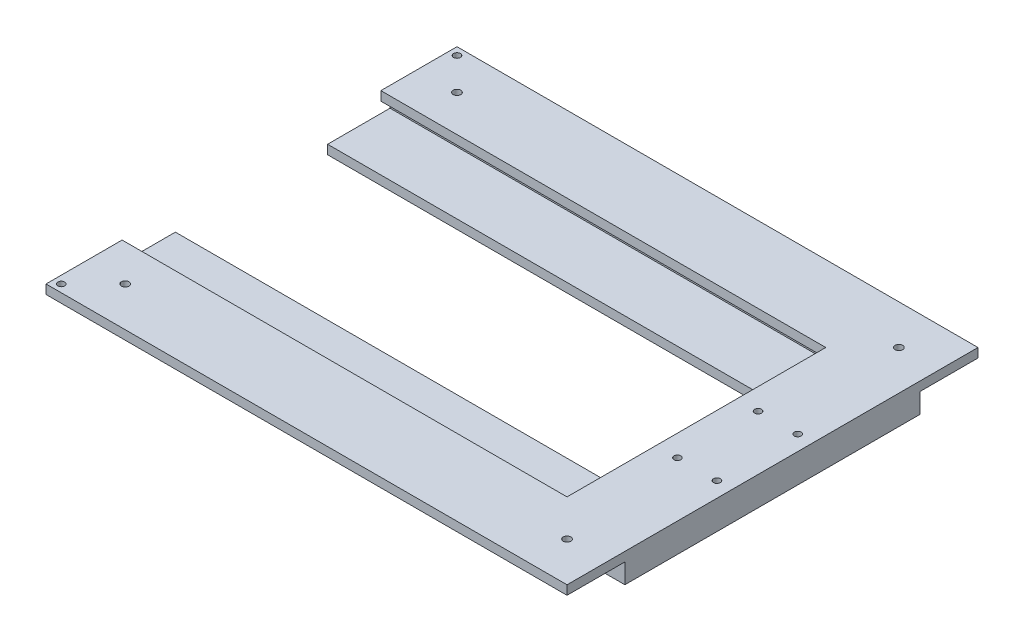
from build123d import *

# Parameters (mm, degrees)
EXTRUDE_2_DEPTH             = 6
EXTRUDE_3_DEPTH             = 7
SKETCH_4_R                  = 2.5
CUT_EXTRUDE_1_DEPTH         = 455.596156824
PATTERN_LINEAR_2_COUNT      = 2
PATTERN_LINEAR_2_PITCH      = 290.3
PATTERN_LINEAR_2_COUNT_DIR2 = 2
PATTERN_LINEAR_2_PITCH_DIR2 = 218
EXTRUDE_4_DEPTH             = 6
SKETCH_6_R                  = 2.25
CUT_EXTRUDE_2_DEPTH         = 455.807284242
SKETCH_7_R                  = 2.25
CUT_EXTRUDE_3_DEPTH         = 455.596156824


with BuildPart() as part:
    # Эскиз1 → Бобышка-Вытянуть2 (new body)
    with BuildSketch(Plane(origin=(0, 0, 0), x_dir=(1, 0, 0), z_dir=(0, 1, 0))):
        Polygon((50, -77.921508101), (50, -347.921508101), (-292.3, -347.921508101), (-292.3, -297.921508101), (0, -297.921508101), (0, -127.921508101), (-292.3, -127.921508101), (-292.3, -77.921508101), align=None)
    extrude(amount=EXTRUDE_2_DEPTH)

    # Эскиз2 → Бобышка-Вытянуть3 (add)
    with BuildSketch(Plane.XZ):
        Polygon((50, 309.921508101), (50, 115.921508101), (-292.3, 115.921508101), (-292.3, 121.921508101), (6, 121.921508101), (6, 303.921508101), (-292.3, 303.921508101), (-292.3, 309.921508101), align=None)
    extrude(amount=EXTRUDE_3_DEPTH)

    # Эскиз4 → Вырез-Вытянуть1 (cut, through all)
    with BuildSketch(Plane(origin=(0, 6, 0), x_dir=(1, 0, 0), z_dir=(0, 1, 0))):
        with Locations((-266.3, -103.921508101)):
            Circle(SKETCH_4_R)
    cut_extrude_1 = extrude(amount=-CUT_EXTRUDE_1_DEPTH, mode=Mode.SUBTRACT)

    # Линейный массив2: Cut-Extrude 1 2 × 2
    with Locations(*[(i * PATTERN_LINEAR_2_PITCH, 0, j * PATTERN_LINEAR_2_PITCH_DIR2) for i in range(PATTERN_LINEAR_2_COUNT) for j in range(PATTERN_LINEAR_2_COUNT_DIR2) if (i, j) != (0, 0)]):
        add(cut_extrude_1, mode=Mode.SUBTRACT)

    # Эскиз5 → Бобышка-Вытянуть4 (add)
    with BuildSketch(Plane.XZ.offset(7)):
        Polygon((50, 309.921508101), (-292.3, 309.921508101), (-292.3, 262.921508101), (0, 262.921508101), (0, 162.921508101), (-292.3, 162.921508101), (-292.3, 115.921508101), (50, 115.921508101), align=None)
    extrude(amount=EXTRUDE_4_DEPTH)

    # Эскиз6 → Вырез-Вытянуть2 (cut, through all)
    with BuildSketch(Plane.XZ.offset(13)):
        with Locations((14, 239.421508101)):
            Circle(SKETCH_6_R)
        with Locations((40, 239.421508101)):
            Circle(SKETCH_6_R)
        with Locations((40, 186.421508101)):
            Circle(SKETCH_6_R)
        with Locations((14, 186.421508101)):
            Circle(SKETCH_6_R)
    extrude(amount=-CUT_EXTRUDE_2_DEPTH, mode=Mode.SUBTRACT)

    # Эскиз7 → Вырез-Вытянуть3 (cut, through all)
    with BuildSketch(Plane.XZ):
        with Locations((-287.3, 342.921508101)):
            Circle(SKETCH_7_R)
        with Locations((-287.3, 82.921508101)):
            Circle(SKETCH_7_R)
    extrude(amount=-CUT_EXTRUDE_3_DEPTH, mode=Mode.SUBTRACT)


solid = part.part
